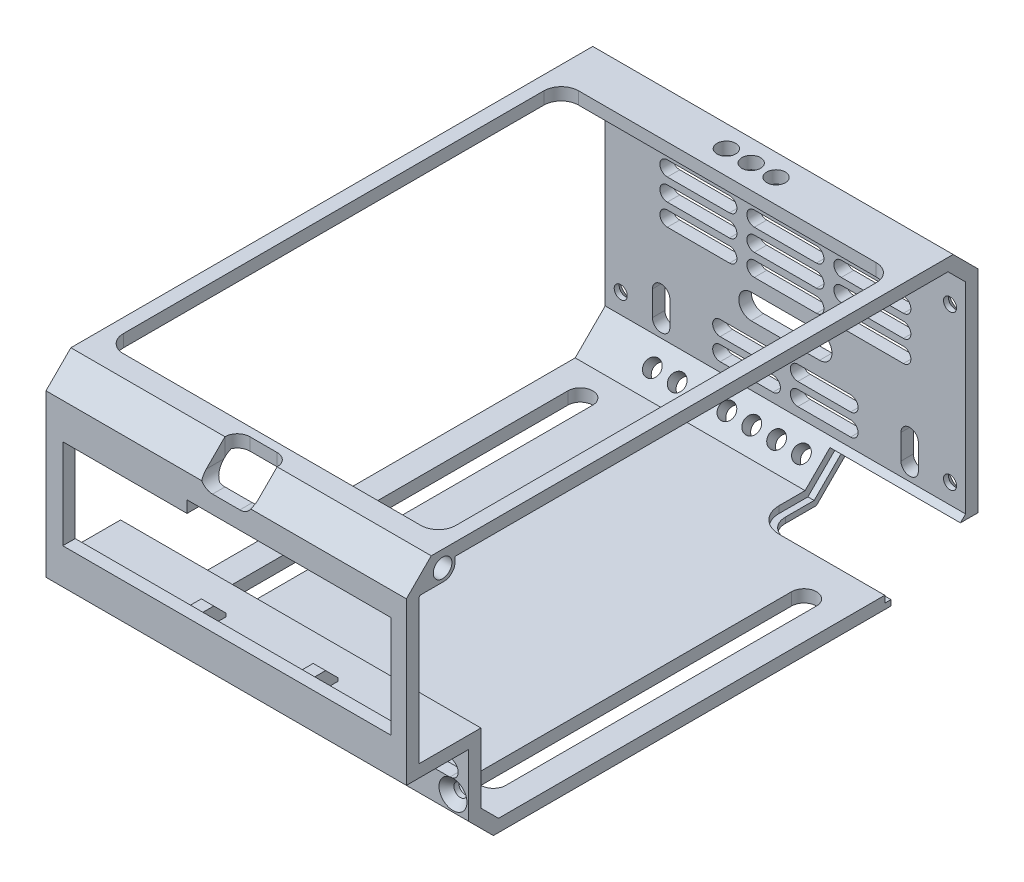
from build123d import *

# Parameters (mm, degrees)
SKETCH_1_W           = 58
SKETCH_1_H           = 92
EXTRUDE_1_DEPTH      = 44
SKETCH_2_W           = 10
SKETCH_2_H           = 14
CUT_EXTRUDE_1_DEPTH  = 92.533461314
CHAMFER_1_SIZE       = 4
CHAMFER_2_SIZE       = 6
CUT_EXTRUDE_2_DEPTH  = 92.533461314
CUT_EXTRUDE_3_REACH  = 108.07
CUT_EXTRUDE_4_REACH  = 78.585
SKETCH_7_W           = 8.4
SKETCH_7_H           = 6
CUT_EXTRUDE_5_DEPTH  = 5
FILLET_1_R           = 2
CUT_EXTRUDE_6_REACH  = 78.585
SKETCH_8_R           = 1.5
SKETCH_9_W           = 2
SKETCH_9_H           = 5
EXTRUDE_2_DEPTH      = 2.5
CHAMFER_4_SIZE       = 2
CHAMFER_5_SIZE       = 2
SKETCH_10_W          = 2
SKETCH_10_H          = 4
SKETCH_10_H_2        = 5
EXTRUDE_3_DEPTH      = 2.6
CUT_EXTRUDE_7_REACH  = 99.523
CUT_EXTRUDE_8_REACH  = 99.523
SKETCH_12_W          = 3.45
SKETCH_12_H          = 2
CUT_EXTRUDE_9_REACH  = 107.366
CUT_EXTRUDE_10_REACH = 108.07
CUT_EXTRUDE_11_REACH = 108.07
CUT_EXTRUDE_12_REACH = 98.782
SKETCH_17_R          = 1.3
CUT_EXTRUDE_13_REACH = 78.585
CUT_EXTRUDE_14_REACH = 108.07
SKETCH_19_R          = 1.05
CUT_EXTRUDE_15_REACH = 99.523
SKETCH_20_R          = 1.05
CHAMFER_6_SIZE       = 1.2
EXTRUDE_4_DEPTH      = 2.5
EXTRUDE_5_DEPTH      = 2.5
SKETCH_23_R          = 1.5
CUT_EXTRUDE_16_DEPTH = 2.5
CUT_EXTRUDE_START    = -2.5
SKETCH_24_R          = 1.5
CUT_EXTRUDE_17_DEPTH = 2.5
FILLET_3_R           = 1.8
SKETCH_25_W          = 15
SKETCH_25_H          = 8
CUT_EXTRUDE_18_DEPTH = 21
EXTRUDE_7_DEPTH      = 1
SKETCH_28_W          = 20
SKETCH_28_H          = 0.9
EXTRUDE_8_DEPTH      = 1
FILLET_4_R           = 3
FILLET_5_R           = 4


with BuildPart() as part:
    # 草图1 → 凸台-拉伸1 (new body)
    with BuildSketch(Plane(origin=(0, 0, 0), x_dir=(1, 0, 0), z_dir=(0, 1, 0))):
        with Locations((0.168986083, -9.483101392)):
            Rectangle(SKETCH_1_W, SKETCH_1_H)
    extrude(amount=EXTRUDE_1_DEPTH)

    # 草图2 → 切除-拉伸1 (cut, through all)
    with BuildSketch(Plane.ZY.offset(28.831013917)):
        with Locations((50.483101392, 7)):
            Rectangle(SKETCH_2_W, SKETCH_2_H)
    extrude(amount=-CUT_EXTRUDE_1_DEPTH, mode=Mode.SUBTRACT)

    # 倒角1
    chamfer_1_edges = [part.edges().sort_by_distance(p)[0] for p in [
        (0.168986083, 44, -36.516898608),
        (0.168986083, 0, 45.483101392),
        (0.168986083, 44, 55.483101392),
    ]]
    chamfer(chamfer_1_edges, length=CHAMFER_1_SIZE)

    # 倒角2
    chamfer_2_edges = [part.edges().sort_by_distance(p)[0] for p in [
        (0.168986083, 0, -36.516898608),
    ]]
    chamfer(chamfer_2_edges, length=CHAMFER_2_SIZE)

    # 草图3 → 切除-拉伸2 (cut, through all)
    with BuildSketch(Plane.ZY.offset(28.831013917)):
        Polygon((-34.516898608, 39.171572875), (-34.516898608, 6.828427125), (-29.688471484, 2), (40.654674267, 2), (43.483101392, 4.828427125), (43.483101392, 16), (53.483101392, 16), (53.483101392, 39.171572875), (50.654674267, 42), (-31.688471484, 42), align=None)
    extrude(amount=-CUT_EXTRUDE_2_DEPTH, mode=Mode.SUBTRACT)

    # 草图4 → 切除-拉伸3 (cut, up to next)
    with BuildSketch(Plane.XY.offset(55.483101392), mode=Mode.PRIVATE) as cut_extrude_3_sk1:
        Polygon((26.668986083, 36.15), (-6.131013917, 36.15), (-6.131013917, 34.25), (-26.131013917, 34.25), (-26.131013917, 19.75), (26.668986083, 19.75), align=None)
    cut_extrude_3_tool1 = extrude(cut_extrude_3_sk1.sketch, amount=-CUT_EXTRUDE_3_REACH, mode=Mode.PRIVATE) & part.part
    add(cut_extrude_3_tool1.solids().sort_by_distance((1.021716, 27.617238, 55.483101))[0], mode=Mode.SUBTRACT)

    # 草图6 → 切除-拉伸4 (cut, up to next)
    with BuildSketch(Plane(origin=(0, 44, 0), x_dir=(1, 0, 0), z_dir=(0, 1, 0)), mode=Mode.PRIVATE) as cut_extrude_4_sk1:
        with BuildLine():
            Line((24.118986083, -48.083101392), (-23.781013917, -48.083101392))
            ThreePointArc((-23.781013917, -48.083101392), (-25.760912904, -47.263000379), (-26.581013917, -45.283101392))
            Line((-26.581013917, -45.283101392), (-26.581013917, 22.388471484))
            ThreePointArc((-26.581013917, 22.388471484), (-25.760912904, 24.368370471), (-23.781013917, 25.188471484))
            Line((-23.781013917, 25.188471484), (24.118986083, 25.188471484))
            ThreePointArc((24.118986083, 25.188471484), (26.098885071, 24.368370471), (26.918986083, 22.388471484))
            Line((26.918986083, 22.388471484), (26.918986083, -45.283101392))
            ThreePointArc((26.918986083, -45.283101392), (26.098885071, -47.263000379), (24.118986083, -48.083101392))
        make_face()
    cut_extrude_4_tool1 = extrude(cut_extrude_4_sk1.sketch, amount=-CUT_EXTRUDE_4_REACH, mode=Mode.PRIVATE) & part.part
    add(cut_extrude_4_tool1.solids().sort_by_distance((0.168986, 44, 11.447315))[0], mode=Mode.SUBTRACT)

    # 草图7 → 切除-拉伸5 (cut)
    with BuildSketch(Plane(origin=(0, 44, 0), x_dir=(1, 0, 0), z_dir=(0, 1, 0))):
        with Locations((0.168986083, -52.483101392)):
            Rectangle(SKETCH_7_W, SKETCH_7_H)
    extrude(amount=-CUT_EXTRUDE_5_DEPTH, mode=Mode.SUBTRACT)

    # 圆角1
    fillet_1_edges = [part.edges().sort_by_distance(p)[0] for p in [
        (-4.031013917, 39, 54.483101392),
        (4.368986083, 39, 54.483101392),
        (-4.031013917, 43, 49.483101392),
        (4.368986083, 43, 49.483101392),
    ]]
    fillet(fillet_1_edges, radius=FILLET_1_R)

    # 草图8 → 切除-拉伸6 (cut, up to next)
    with BuildSketch(Plane(origin=(0, 44, 0), x_dir=(1, 0, 0), z_dir=(0, 1, 0)), mode=Mode.PRIVATE) as cut_extrude_6_sk1:
        with Locations(Location((4.168986083, 29.016898608, 0), (0, 0, 270))):
            Circle(SKETCH_8_R)
    cut_extrude_6_tool1 = extrude(cut_extrude_6_sk1.sketch, amount=-CUT_EXTRUDE_6_REACH, mode=Mode.PRIVATE) & part.part
    # 草图8 → 切除-拉伸6 (cut, up to next)
    with BuildSketch(Plane(origin=(0, 44, 0), x_dir=(1, 0, 0), z_dir=(0, 1, 0)), mode=Mode.PRIVATE) as cut_extrude_6_sk2:
        with Locations(Location((0.168986083, 29.016898608, 0), (0, 0, 270))):
            Circle(SKETCH_8_R)
    cut_extrude_6_tool2 = extrude(cut_extrude_6_sk2.sketch, amount=-CUT_EXTRUDE_6_REACH, mode=Mode.PRIVATE) & part.part
    # 草图8 → 切除-拉伸6 (cut, up to next)
    with BuildSketch(Plane(origin=(0, 44, 0), x_dir=(1, 0, 0), z_dir=(0, 1, 0)), mode=Mode.PRIVATE) as cut_extrude_6_sk3:
        with Locations(Location((-3.831013917, 29.016898608, 0), (0, 0, 270))):
            Circle(SKETCH_8_R)
    cut_extrude_6_tool3 = extrude(cut_extrude_6_sk3.sketch, amount=-CUT_EXTRUDE_6_REACH, mode=Mode.PRIVATE) & part.part
    add(cut_extrude_6_tool1.solids().sort_by_distance((4.168986, 44, -29.016899))[0], mode=Mode.SUBTRACT)
    add(cut_extrude_6_tool2.solids().sort_by_distance((0.168986, 44, -29.016899))[0], mode=Mode.SUBTRACT)
    add(cut_extrude_6_tool3.solids().sort_by_distance((-3.831014, 44, -29.016899))[0], mode=Mode.SUBTRACT)

    # 草图9 → 凸台-拉伸2 (add)
    with BuildSketch(Plane(origin=(0, 16, 0), x_dir=(1, 0, 0), z_dir=(0, 1, 0))):
        with Locations((10.168986083, -50.983101392)):
            Rectangle(SKETCH_9_W, SKETCH_9_H)
        with Locations((-7.831013917, -50.983101392)):
            Rectangle(SKETCH_9_W, SKETCH_9_H)
    extrude(amount=EXTRUDE_2_DEPTH)

    # 倒角4
    chamfer_4_edges = [part.edges().sort_by_distance(p)[0] for p in [
        (10.168986083, 18.5, 48.483101392),
    ]]
    chamfer(chamfer_4_edges, length=CHAMFER_4_SIZE)

    # 倒角5
    chamfer_5_edges = [part.edges().sort_by_distance(p)[0] for p in [
        (-7.831013917, 18.5, 48.483101392),
    ]]
    chamfer(chamfer_5_edges, length=CHAMFER_5_SIZE)

    # 草图10 → 凸台-拉伸3 (add)
    with BuildSketch(Plane(origin=(0, 42, 0), x_dir=(-1, 0, 0), z_dir=(0, -1, 0))):
        with Locations((19.831013917, -51.483101392)):
            Rectangle(SKETCH_10_W, SKETCH_10_H)
        with Locations((-20.168986083, -51.483101392)):
            Rectangle(SKETCH_10_W, SKETCH_10_H)
        with Locations((-12.168986083, 32.016898608)):
            Rectangle(SKETCH_10_W, SKETCH_10_H_2)
        with Locations((11.831013917, 32.016898608)):
            Rectangle(SKETCH_10_W, SKETCH_10_H_2)
    extrude(amount=EXTRUDE_3_DEPTH)

    # 草图11 → 切除-拉伸7 (cut, up to next)
    with BuildSketch(Plane.XY.offset(45.483101392), mode=Mode.PRIVATE) as cut_extrude_7_sk1:
        with BuildLine():
            Line((26.168986084, 8.66), (-25.831013917, 8.66))
            ThreePointArc((-25.831013917, 8.66), (-27.171013917, 10), (-25.831013917, 11.34))
            Line((-25.831013917, 11.34), (26.168986084, 11.34))
            ThreePointArc((26.168986084, 11.34), (27.508986084, 10), (26.168986084, 8.66))
        make_face()
    cut_extrude_7_tool1 = extrude(cut_extrude_7_sk1.sketch, amount=-CUT_EXTRUDE_7_REACH, mode=Mode.PRIVATE) & part.part
    add(cut_extrude_7_tool1.solids().sort_by_distance((0.168986, 10, 45.483101))[0], mode=Mode.SUBTRACT)

    # 草图12 → 切除-拉伸8 (cut, up to next)
    with BuildSketch(Plane.XY.offset(45.483101392), mode=Mode.PRIVATE) as cut_extrude_8_sk1:
        with Locations((-22.156013917, 12.34)):
            Rectangle(SKETCH_12_W, SKETCH_12_H)
    cut_extrude_8_tool1 = extrude(cut_extrude_8_sk1.sketch, amount=-CUT_EXTRUDE_8_REACH, mode=Mode.PRIVATE) & part.part
    # 草图12 → 切除-拉伸8 (cut, up to next)
    with BuildSketch(Plane.XY.offset(45.483101392), mode=Mode.PRIVATE) as cut_extrude_8_sk2:
        with Locations((-8.156013917, 12.34)):
            Rectangle(SKETCH_12_W, SKETCH_12_H)
    cut_extrude_8_tool2 = extrude(cut_extrude_8_sk2.sketch, amount=-CUT_EXTRUDE_8_REACH, mode=Mode.PRIVATE) & part.part
    add(cut_extrude_8_tool1.solids().sort_by_distance((-22.156014, 12.34, 45.483101))[0], mode=Mode.SUBTRACT)
    add(cut_extrude_8_tool2.solids().sort_by_distance((-8.156014, 12.34, 45.483101))[0], mode=Mode.SUBTRACT)

    # 草图13 → 切除-拉伸9 (cut, up to next)
    with BuildSketch(Plane(origin=(0, 38.258449304, -38.258449304), x_dir=(1, 0, 0), z_dir=(0, 0.707106781186546, -0.707106781186549)), mode=Mode.PRIVATE) as cut_extrude_9_sk1:
        with BuildLine():
            Line((6.168986083, -6.662924614), (-5.831013917, -6.662924614))
            ThreePointArc((-5.831013917, -6.662924614), (-7.031013917, -5.462924614), (-5.831013917, -4.262924614))
            Line((-5.831013917, -4.262924614), (6.168986083, -4.262924614))
            ThreePointArc((6.168986083, -4.262924614), (7.368986083, -5.462924614), (6.168986083, -6.662924614))
        make_face()
    cut_extrude_9_tool1 = extrude(cut_extrude_9_sk1.sketch, amount=-CUT_EXTRUDE_9_REACH, mode=Mode.PRIVATE) & part.part
    add(cut_extrude_9_tool1.solids().sort_by_distance((0.168986, 42.12132, -34.395578))[0], mode=Mode.SUBTRACT)

    # 草图14 → 切除-拉伸10 (cut, up to next)
    with BuildSketch(Plane(origin=(0, 0, -36.516898608), x_dir=(-1, 0, 0), z_dir=(0, 0, -1)), mode=Mode.PRIVATE) as cut_extrude_10_sk1:
        with BuildLine():
            Line((-5.668986083, 20.5), (5.331013917, 20.5))
            ThreePointArc((5.331013917, 20.5), (7.331013917, 18.5), (5.331013917, 16.5))
            Line((5.331013917, 16.5), (-5.668986083, 16.5))
            ThreePointArc((-5.668986083, 16.5), (-7.668986083, 18.5), (-5.668986083, 20.5))
        make_face()
    cut_extrude_10_tool1 = extrude(cut_extrude_10_sk1.sketch, amount=-CUT_EXTRUDE_10_REACH, mode=Mode.PRIVATE) & part.part
    add(cut_extrude_10_tool1.solids().sort_by_distance((0.168986, 18.5, -36.516899))[0], mode=Mode.SUBTRACT)

    # 草图15 → 切除-拉伸11 (cut, up to next)
    with BuildSketch(Plane(origin=(0, 0, -36.516898608), x_dir=(-1, 0, 0), z_dir=(0, 0, -1)), mode=Mode.PRIVATE) as cut_extrude_11_sk1:
        with BuildLine():
            Line((-9.168986083, 36.8), (-19.168986083, 36.8))
            ThreePointArc((-19.168986083, 36.8), (-20.368986083, 38), (-19.168986083, 39.2))
            Line((-19.168986083, 39.2), (-9.168986083, 39.2))
            ThreePointArc((-9.168986083, 39.2), (-7.968986083, 38), (-9.168986083, 36.8))
        make_face()
    cut_extrude_11_tool1 = extrude(cut_extrude_11_sk1.sketch, amount=-CUT_EXTRUDE_11_REACH, mode=Mode.PRIVATE) & part.part
    # 草图15 → 切除-拉伸11 (cut, up to next)
    with BuildSketch(Plane(origin=(0, 0, -36.516898608), x_dir=(-1, 0, 0), z_dir=(0, 0, -1)), mode=Mode.PRIVATE) as cut_extrude_11_sk2:
        with BuildLine():
            Line((4.831013917, 36.8), (-5.168986083, 36.8))
            ThreePointArc((-5.168986083, 36.8), (-6.368986083, 38), (-5.168986083, 39.2))
            Line((-5.168986083, 39.2), (4.831013917, 39.2))
            ThreePointArc((4.831013917, 39.2), (6.031013917, 38), (4.831013917, 36.8))
        make_face()
    cut_extrude_11_tool2 = extrude(cut_extrude_11_sk2.sketch, amount=-CUT_EXTRUDE_11_REACH, mode=Mode.PRIVATE) & part.part
    # 草图15 → 切除-拉伸11 (cut, up to next)
    with BuildSketch(Plane(origin=(0, 0, -36.516898608), x_dir=(-1, 0, 0), z_dir=(0, 0, -1)), mode=Mode.PRIVATE) as cut_extrude_11_sk3:
        with BuildLine():
            Line((4.831013917, 33.3), (-5.168986083, 33.3))
            ThreePointArc((-5.168986083, 33.3), (-6.368986083, 34.5), (-5.168986083, 35.7))
            Line((-5.168986083, 35.7), (4.831013917, 35.7))
            ThreePointArc((4.831013917, 35.7), (6.031013917, 34.5), (4.831013917, 33.3))
        make_face()
    cut_extrude_11_tool3 = extrude(cut_extrude_11_sk3.sketch, amount=-CUT_EXTRUDE_11_REACH, mode=Mode.PRIVATE) & part.part
    # 草图15 → 切除-拉伸11 (cut, up to next)
    with BuildSketch(Plane(origin=(0, 0, -36.516898608), x_dir=(-1, 0, 0), z_dir=(0, 0, -1)), mode=Mode.PRIVATE) as cut_extrude_11_sk4:
        with BuildLine():
            Line((4.831013917, 29.8), (-5.168986083, 29.8))
            ThreePointArc((-5.168986083, 29.8), (-6.368986083, 31), (-5.168986083, 32.2))
            Line((-5.168986083, 32.2), (4.831013917, 32.2))
            ThreePointArc((4.831013917, 32.2), (6.031013917, 31), (4.831013917, 29.8))
        make_face()
    cut_extrude_11_tool4 = extrude(cut_extrude_11_sk4.sketch, amount=-CUT_EXTRUDE_11_REACH, mode=Mode.PRIVATE) & part.part
    # 草图15 → 切除-拉伸11 (cut, up to next)
    with BuildSketch(Plane(origin=(0, 0, -36.516898608), x_dir=(-1, 0, 0), z_dir=(0, 0, -1)), mode=Mode.PRIVATE) as cut_extrude_11_sk5:
        with BuildLine():
            Line((18.831013917, 29.8), (8.831013917, 29.8))
            ThreePointArc((8.831013917, 29.8), (7.631013917, 31), (8.831013917, 32.2))
            Line((8.831013917, 32.2), (18.831013917, 32.2))
            ThreePointArc((18.831013917, 32.2), (20.031013917, 31), (18.831013917, 29.8))
        make_face()
    cut_extrude_11_tool5 = extrude(cut_extrude_11_sk5.sketch, amount=-CUT_EXTRUDE_11_REACH, mode=Mode.PRIVATE) & part.part
    # 草图15 → 切除-拉伸11 (cut, up to next)
    with BuildSketch(Plane(origin=(0, 0, -36.516898608), x_dir=(-1, 0, 0), z_dir=(0, 0, -1)), mode=Mode.PRIVATE) as cut_extrude_11_sk6:
        with BuildLine():
            Line((4.831013917, 26.3), (-5.168986083, 26.3))
            ThreePointArc((-5.168986083, 26.3), (-6.368986083, 27.5), (-5.168986083, 28.7))
            Line((-5.168986083, 28.7), (4.831013917, 28.7))
            ThreePointArc((4.831013917, 28.7), (6.031013917, 27.5), (4.831013917, 26.3))
        make_face()
    cut_extrude_11_tool6 = extrude(cut_extrude_11_sk6.sketch, amount=-CUT_EXTRUDE_11_REACH, mode=Mode.PRIVATE) & part.part
    # 草图15 → 切除-拉伸11 (cut, up to next)
    with BuildSketch(Plane(origin=(0, 0, -36.516898608), x_dir=(-1, 0, 0), z_dir=(0, 0, -1)), mode=Mode.PRIVATE) as cut_extrude_11_sk7:
        with BuildLine():
            Line((18.831013917, 26.3), (8.831013917, 26.3))
            ThreePointArc((8.831013917, 26.3), (7.631013917, 27.5), (8.831013917, 28.7))
            Line((8.831013917, 28.7), (18.831013917, 28.7))
            ThreePointArc((18.831013917, 28.7), (20.031013917, 27.5), (18.831013917, 26.3))
        make_face()
    cut_extrude_11_tool7 = extrude(cut_extrude_11_sk7.sketch, amount=-CUT_EXTRUDE_11_REACH, mode=Mode.PRIVATE) & part.part
    # 草图15 → 切除-拉伸11 (cut, up to next)
    with BuildSketch(Plane(origin=(0, 0, -36.516898608), x_dir=(-1, 0, 0), z_dir=(0, 0, -1)), mode=Mode.PRIVATE) as cut_extrude_11_sk8:
        with BuildLine():
            Line((4.831013917, 22.8), (-5.168986083, 22.8))
            ThreePointArc((-5.168986083, 22.8), (-6.368986083, 24), (-5.168986083, 25.2))
            Line((-5.168986083, 25.2), (4.831013917, 25.2))
            ThreePointArc((4.831013917, 25.2), (6.031013917, 24), (4.831013917, 22.8))
        make_face()
    cut_extrude_11_tool8 = extrude(cut_extrude_11_sk8.sketch, amount=-CUT_EXTRUDE_11_REACH, mode=Mode.PRIVATE) & part.part
    # 草图15 → 切除-拉伸11 (cut, up to next)
    with BuildSketch(Plane(origin=(0, 0, -36.516898608), x_dir=(-1, 0, 0), z_dir=(0, 0, -1)), mode=Mode.PRIVATE) as cut_extrude_11_sk9:
        with BuildLine():
            Line((18.831013917, 22.8), (8.831013917, 22.8))
            ThreePointArc((8.831013917, 22.8), (7.631013917, 24), (8.831013917, 25.2))
            Line((8.831013917, 25.2), (18.831013917, 25.2))
            ThreePointArc((18.831013917, 25.2), (20.031013917, 24), (18.831013917, 22.8))
        make_face()
    cut_extrude_11_tool9 = extrude(cut_extrude_11_sk9.sketch, amount=-CUT_EXTRUDE_11_REACH, mode=Mode.PRIVATE) & part.part
    # 草图15 → 切除-拉伸11 (cut, up to next)
    with BuildSketch(Plane(origin=(0, 0, -36.516898608), x_dir=(-1, 0, 0), z_dir=(0, 0, -1)), mode=Mode.PRIVATE) as cut_extrude_11_sk10:
        with BuildLine():
            Line((-9.168986083, 33.3), (-19.168986083, 33.3))
            ThreePointArc((-19.168986083, 33.3), (-20.368986083, 34.5), (-19.168986083, 35.7))
            Line((-19.168986083, 35.7), (-9.168986083, 35.7))
            ThreePointArc((-9.168986083, 35.7), (-7.968986083, 34.5), (-9.168986083, 33.3))
        make_face()
    cut_extrude_11_tool10 = extrude(cut_extrude_11_sk10.sketch, amount=-CUT_EXTRUDE_11_REACH, mode=Mode.PRIVATE) & part.part
    # 草图15 → 切除-拉伸11 (cut, up to next)
    with BuildSketch(Plane(origin=(0, 0, -36.516898608), x_dir=(-1, 0, 0), z_dir=(0, 0, -1)), mode=Mode.PRIVATE) as cut_extrude_11_sk11:
        with BuildLine():
            Line((-9.168986083, 29.8), (-19.168986083, 29.8))
            ThreePointArc((-19.168986083, 29.8), (-20.368986083, 31), (-19.168986083, 32.2))
            Line((-19.168986083, 32.2), (-9.168986083, 32.2))
            ThreePointArc((-9.168986083, 32.2), (-7.968986083, 31), (-9.168986083, 29.8))
        make_face()
    cut_extrude_11_tool11 = extrude(cut_extrude_11_sk11.sketch, amount=-CUT_EXTRUDE_11_REACH, mode=Mode.PRIVATE) & part.part
    # 草图15 → 切除-拉伸11 (cut, up to next)
    with BuildSketch(Plane(origin=(0, 0, -36.516898608), x_dir=(-1, 0, 0), z_dir=(0, 0, -1)), mode=Mode.PRIVATE) as cut_extrude_11_sk12:
        with BuildLine():
            Line((-9.168986083, 26.3), (-19.168986083, 26.3))
            ThreePointArc((-19.168986083, 26.3), (-20.368986083, 27.5), (-19.168986083, 28.7))
            Line((-19.168986083, 28.7), (-9.168986083, 28.7))
            ThreePointArc((-9.168986083, 28.7), (-7.968986083, 27.5), (-9.168986083, 26.3))
        make_face()
    cut_extrude_11_tool12 = extrude(cut_extrude_11_sk12.sketch, amount=-CUT_EXTRUDE_11_REACH, mode=Mode.PRIVATE) & part.part
    # 草图15 → 切除-拉伸11 (cut, up to next)
    with BuildSketch(Plane(origin=(0, 0, -36.516898608), x_dir=(-1, 0, 0), z_dir=(0, 0, -1)), mode=Mode.PRIVATE) as cut_extrude_11_sk13:
        with BuildLine():
            Line((-9.168986083, 22.8), (-19.168986083, 22.8))
            ThreePointArc((-19.168986083, 22.8), (-20.368986083, 24), (-19.168986083, 25.2))
            Line((-19.168986083, 25.2), (-9.168986083, 25.2))
            ThreePointArc((-9.168986083, 25.2), (-7.968986083, 24), (-9.168986083, 22.8))
        make_face()
    cut_extrude_11_tool13 = extrude(cut_extrude_11_sk13.sketch, amount=-CUT_EXTRUDE_11_REACH, mode=Mode.PRIVATE) & part.part
    # 草图15 → 切除-拉伸11 (cut, up to next)
    with BuildSketch(Plane(origin=(0, 0, -36.516898608), x_dir=(-1, 0, 0), z_dir=(0, 0, -1)), mode=Mode.PRIVATE) as cut_extrude_11_sk14:
        with BuildLine():
            Line((-18.768986083, 13), (-18.768986083, 9))
            ThreePointArc((-18.768986083, 9), (-20.168986083, 7.6), (-21.568986083, 9))
            Line((-21.568986083, 9), (-21.568986083, 13))
            ThreePointArc((-21.568986083, 13), (-20.168986083, 14.4), (-18.768986083, 13))
        make_face()
    cut_extrude_11_tool14 = extrude(cut_extrude_11_sk14.sketch, amount=-CUT_EXTRUDE_11_REACH, mode=Mode.PRIVATE) & part.part
    # 草图15 → 切除-拉伸11 (cut, up to next)
    with BuildSketch(Plane(origin=(0, 0, -36.516898608), x_dir=(-1, 0, 0), z_dir=(0, 0, -1)), mode=Mode.PRIVATE) as cut_extrude_11_sk15:
        with BuildLine():
            Line((18.431013917, 13), (18.431013917, 9))
            ThreePointArc((18.431013917, 9), (19.831013917, 7.6), (21.231013917, 9))
            Line((21.231013917, 9), (21.231013917, 13))
            ThreePointArc((21.231013917, 13), (19.831013917, 14.4), (18.431013917, 13))
        make_face()
    cut_extrude_11_tool15 = extrude(cut_extrude_11_sk15.sketch, amount=-CUT_EXTRUDE_11_REACH, mode=Mode.PRIVATE) & part.part
    # 草图15 → 切除-拉伸11 (cut, up to next)
    with BuildSketch(Plane(origin=(0, 0, -36.516898608), x_dir=(-1, 0, 0), z_dir=(0, 0, -1)), mode=Mode.PRIVATE) as cut_extrude_11_sk16:
        with BuildLine():
            Line((-10.668986083, 14.2), (-2.168986083, 14.2))
            ThreePointArc((-2.168986083, 14.2), (-0.968986083, 13), (-2.168986083, 11.8))
            Line((-2.168986083, 11.8), (-10.668986083, 11.8))
            ThreePointArc((-10.668986083, 11.8), (-11.868986083, 13), (-10.668986083, 14.2))
        make_face()
    cut_extrude_11_tool16 = extrude(cut_extrude_11_sk16.sketch, amount=-CUT_EXTRUDE_11_REACH, mode=Mode.PRIVATE) & part.part
    # 草图15 → 切除-拉伸11 (cut, up to next)
    with BuildSketch(Plane(origin=(0, 0, -36.516898608), x_dir=(-1, 0, 0), z_dir=(0, 0, -1)), mode=Mode.PRIVATE) as cut_extrude_11_sk17:
        with BuildLine():
            Line((-10.668986083, 10.7), (-2.168986083, 10.7))
            ThreePointArc((-2.168986083, 10.7), (-0.968986083, 9.5), (-2.168986083, 8.3))
            Line((-2.168986083, 8.3), (-10.668986083, 8.3))
            ThreePointArc((-10.668986083, 8.3), (-11.868986083, 9.5), (-10.668986083, 10.7))
        make_face()
    cut_extrude_11_tool17 = extrude(cut_extrude_11_sk17.sketch, amount=-CUT_EXTRUDE_11_REACH, mode=Mode.PRIVATE) & part.part
    # 草图15 → 切除-拉伸11 (cut, up to next)
    with BuildSketch(Plane(origin=(0, 0, -36.516898608), x_dir=(-1, 0, 0), z_dir=(0, 0, -1)), mode=Mode.PRIVATE) as cut_extrude_11_sk18:
        with BuildLine():
            Line((10.331013917, 14.2), (1.831013917, 14.2))
            ThreePointArc((1.831013917, 14.2), (0.631013917, 13), (1.831013917, 11.8))
            Line((1.831013917, 11.8), (10.331013917, 11.8))
            ThreePointArc((10.331013917, 11.8), (11.531013917, 13), (10.331013917, 14.2))
        make_face()
    cut_extrude_11_tool18 = extrude(cut_extrude_11_sk18.sketch, amount=-CUT_EXTRUDE_11_REACH, mode=Mode.PRIVATE) & part.part
    # 草图15 → 切除-拉伸11 (cut, up to next)
    with BuildSketch(Plane(origin=(0, 0, -36.516898608), x_dir=(-1, 0, 0), z_dir=(0, 0, -1)), mode=Mode.PRIVATE) as cut_extrude_11_sk19:
        with BuildLine():
            Line((10.331013917, 10.7), (1.831013917, 10.7))
            ThreePointArc((1.831013917, 10.7), (0.631013917, 9.5), (1.831013917, 8.3))
            Line((1.831013917, 8.3), (10.331013917, 8.3))
            ThreePointArc((10.331013917, 8.3), (11.531013917, 9.5), (10.331013917, 10.7))
        make_face()
    cut_extrude_11_tool19 = extrude(cut_extrude_11_sk19.sketch, amount=-CUT_EXTRUDE_11_REACH, mode=Mode.PRIVATE) & part.part
    # 草图15 → 切除-拉伸11 (cut, up to next)
    with BuildSketch(Plane(origin=(0, 0, -36.516898608), x_dir=(-1, 0, 0), z_dir=(0, 0, -1)), mode=Mode.PRIVATE) as cut_extrude_11_sk20:
        with BuildLine():
            Line((9.831013917, 39.2), (21.831013917, 39.2))
            ThreePointArc((21.831013917, 39.2), (22.538120698, 38.907106781), (22.831013917, 38.2))
            Line((22.831013917, 38.2), (22.831013917, 34.3))
            ThreePointArc((22.831013917, 34.3), (22.538120698, 33.592893219), (21.831013917, 33.3))
            Line((21.831013917, 33.3), (9.831013917, 33.3))
            ThreePointArc((9.831013917, 33.3), (9.123907135, 33.592893219), (8.831013917, 34.3))
            Line((8.831013917, 34.3), (8.831013917, 38.2))
            ThreePointArc((8.831013917, 38.2), (9.123907135, 38.907106781), (9.831013917, 39.2))
        make_face()
    cut_extrude_11_tool20 = extrude(cut_extrude_11_sk20.sketch, amount=-CUT_EXTRUDE_11_REACH, mode=Mode.PRIVATE) & part.part
    add(cut_extrude_11_tool1.solids().sort_by_distance((14.168986, 38, -36.516899))[0], mode=Mode.SUBTRACT)
    add(cut_extrude_11_tool2.solids().sort_by_distance((0.168986, 38, -36.516899))[0], mode=Mode.SUBTRACT)
    add(cut_extrude_11_tool3.solids().sort_by_distance((0.168986, 34.5, -36.516899))[0], mode=Mode.SUBTRACT)
    add(cut_extrude_11_tool4.solids().sort_by_distance((0.168986, 31, -36.516899))[0], mode=Mode.SUBTRACT)
    add(cut_extrude_11_tool5.solids().sort_by_distance((-13.831014, 31, -36.516899))[0], mode=Mode.SUBTRACT)
    add(cut_extrude_11_tool6.solids().sort_by_distance((0.168986, 27.5, -36.516899))[0], mode=Mode.SUBTRACT)
    add(cut_extrude_11_tool7.solids().sort_by_distance((-13.831014, 27.5, -36.516899))[0], mode=Mode.SUBTRACT)
    add(cut_extrude_11_tool8.solids().sort_by_distance((0.168986, 24, -36.516899))[0], mode=Mode.SUBTRACT)
    add(cut_extrude_11_tool9.solids().sort_by_distance((-13.831014, 24, -36.516899))[0], mode=Mode.SUBTRACT)
    add(cut_extrude_11_tool10.solids().sort_by_distance((14.168986, 34.5, -36.516899))[0], mode=Mode.SUBTRACT)
    add(cut_extrude_11_tool11.solids().sort_by_distance((14.168986, 31, -36.516899))[0], mode=Mode.SUBTRACT)
    add(cut_extrude_11_tool12.solids().sort_by_distance((14.168986, 27.5, -36.516899))[0], mode=Mode.SUBTRACT)
    add(cut_extrude_11_tool13.solids().sort_by_distance((14.168986, 24, -36.516899))[0], mode=Mode.SUBTRACT)
    add(cut_extrude_11_tool14.solids().sort_by_distance((20.168986, 11, -36.516899))[0], mode=Mode.SUBTRACT)
    add(cut_extrude_11_tool15.solids().sort_by_distance((-19.831014, 11, -36.516899))[0], mode=Mode.SUBTRACT)
    add(cut_extrude_11_tool16.solids().sort_by_distance((6.418986, 13, -36.516899))[0], mode=Mode.SUBTRACT)
    add(cut_extrude_11_tool17.solids().sort_by_distance((6.418986, 9.5, -36.516899))[0], mode=Mode.SUBTRACT)
    add(cut_extrude_11_tool18.solids().sort_by_distance((-6.081014, 13, -36.516899))[0], mode=Mode.SUBTRACT)
    add(cut_extrude_11_tool19.solids().sort_by_distance((-6.081014, 9.5, -36.516899))[0], mode=Mode.SUBTRACT)
    add(cut_extrude_11_tool20.solids().sort_by_distance((-15.831014, 36.25, -36.516899))[0], mode=Mode.SUBTRACT)

    # 草图17 → 切除-拉伸12 (cut, up to next)
    with BuildSketch(Plane(origin=(0, -15.258449304, -15.258449304), x_dir=(1, 0, 0), z_dir=(0, -0.7071067811865483, -0.7071067811865468)), mode=Mode.PRIVATE) as cut_extrude_12_sk1:
        with Locations(Location((5.168986083, -25.821346634, 0), (0, 0, 270))):
            Circle(SKETCH_17_R)
    cut_extrude_12_tool1 = extrude(cut_extrude_12_sk1.sketch, amount=-CUT_EXTRUDE_12_REACH, mode=Mode.PRIVATE) & part.part
    # 草图17 → 切除-拉伸12 (cut, up to next)
    with BuildSketch(Plane(origin=(0, -15.258449304, -15.258449304), x_dir=(1, 0, 0), z_dir=(0, -0.7071067811865483, -0.7071067811865468)), mode=Mode.PRIVATE) as cut_extrude_12_sk2:
        with Locations(Location((1.168986083, -25.821346634, 0), (0, 0, 270))):
            Circle(SKETCH_17_R)
    cut_extrude_12_tool2 = extrude(cut_extrude_12_sk2.sketch, amount=-CUT_EXTRUDE_12_REACH, mode=Mode.PRIVATE) & part.part
    # 草图17 → 切除-拉伸12 (cut, up to next)
    with BuildSketch(Plane(origin=(0, -15.258449304, -15.258449304), x_dir=(1, 0, 0), z_dir=(0, -0.7071067811865483, -0.7071067811865468)), mode=Mode.PRIVATE) as cut_extrude_12_sk3:
        with Locations(Location((-2.831013917, -25.821346634, 0), (0, 0, 270))):
            Circle(SKETCH_17_R)
    cut_extrude_12_tool3 = extrude(cut_extrude_12_sk3.sketch, amount=-CUT_EXTRUDE_12_REACH, mode=Mode.PRIVATE) & part.part
    # 草图17 → 切除-拉伸12 (cut, up to next)
    with BuildSketch(Plane(origin=(0, -15.258449304, -15.258449304), x_dir=(1, 0, 0), z_dir=(0, -0.7071067811865483, -0.7071067811865468)), mode=Mode.PRIVATE) as cut_extrude_12_sk4:
        with Locations(Location((-6.831013917, -25.821346634, 0), (0, 0, 270))):
            Circle(SKETCH_17_R)
    cut_extrude_12_tool4 = extrude(cut_extrude_12_sk4.sketch, amount=-CUT_EXTRUDE_12_REACH, mode=Mode.PRIVATE) & part.part
    # 草图17 → 切除-拉伸12 (cut, up to next)
    with BuildSketch(Plane(origin=(0, -15.258449304, -15.258449304), x_dir=(1, 0, 0), z_dir=(0, -0.7071067811865483, -0.7071067811865468)), mode=Mode.PRIVATE) as cut_extrude_12_sk5:
        with Locations(Location((-10.831013917, -25.821346634, 0), (0, 0, 270))):
            Circle(SKETCH_17_R)
    cut_extrude_12_tool5 = extrude(cut_extrude_12_sk5.sketch, amount=-CUT_EXTRUDE_12_REACH, mode=Mode.PRIVATE) & part.part
    # 草图17 → 切除-拉伸12 (cut, up to next)
    with BuildSketch(Plane(origin=(0, -15.258449304, -15.258449304), x_dir=(1, 0, 0), z_dir=(0, -0.7071067811865483, -0.7071067811865468)), mode=Mode.PRIVATE) as cut_extrude_12_sk6:
        with Locations(Location((-14.831013917, -25.821346634, 0), (0, 0, 270))):
            Circle(SKETCH_17_R)
    cut_extrude_12_tool6 = extrude(cut_extrude_12_sk6.sketch, amount=-CUT_EXTRUDE_12_REACH, mode=Mode.PRIVATE) & part.part
    # 草图17 → 切除-拉伸12 (cut, up to next)
    with BuildSketch(Plane(origin=(0, -15.258449304, -15.258449304), x_dir=(1, 0, 0), z_dir=(0, -0.7071067811865483, -0.7071067811865468)), mode=Mode.PRIVATE) as cut_extrude_12_sk7:
        with Locations(Location((-18.831013917, -25.821346634, 0), (0, 0, 270))):
            Circle(SKETCH_17_R)
    cut_extrude_12_tool7 = extrude(cut_extrude_12_sk7.sketch, amount=-CUT_EXTRUDE_12_REACH, mode=Mode.PRIVATE) & part.part
    add(cut_extrude_12_tool1.solids().sort_by_distance((5.168986, 3, -33.516899))[0], mode=Mode.SUBTRACT)
    add(cut_extrude_12_tool2.solids().sort_by_distance((1.168986, 3, -33.516899))[0], mode=Mode.SUBTRACT)
    add(cut_extrude_12_tool3.solids().sort_by_distance((-2.831014, 3, -33.516899))[0], mode=Mode.SUBTRACT)
    add(cut_extrude_12_tool4.solids().sort_by_distance((-6.831014, 3, -33.516899))[0], mode=Mode.SUBTRACT)
    add(cut_extrude_12_tool5.solids().sort_by_distance((-10.831014, 3, -33.516899))[0], mode=Mode.SUBTRACT)
    add(cut_extrude_12_tool6.solids().sort_by_distance((-14.831014, 3, -33.516899))[0], mode=Mode.SUBTRACT)
    add(cut_extrude_12_tool7.solids().sort_by_distance((-18.831014, 3, -33.516899))[0], mode=Mode.SUBTRACT)

    # 草图18 → 切除-拉伸13 (cut, up to next)
    with BuildSketch(Plane.XZ, mode=Mode.PRIVATE) as cut_extrude_13_sk1:
        with BuildLine():
            Line((25.168986083, 35.483101392), (25.168986083, -14.516898608))
            ThreePointArc((25.168986083, -14.516898608), (23.168986083, -16.516898608), (21.168986083, -14.516898608))
            Line((21.168986083, -14.516898608), (21.168986083, 35.483101392))
            ThreePointArc((21.168986083, 35.483101392), (23.168986083, 37.483101392), (25.168986083, 35.483101392))
        make_face()
    cut_extrude_13_tool1 = extrude(cut_extrude_13_sk1.sketch, amount=-CUT_EXTRUDE_13_REACH, mode=Mode.PRIVATE) & part.part
    # 草图18 → 切除-拉伸13 (cut, up to next)
    with BuildSketch(Plane.XZ, mode=Mode.PRIVATE) as cut_extrude_13_sk2:
        with BuildLine():
            Line((-20.831013917, 35.483101392), (-20.831013917, -24.516898608))
            ThreePointArc((-20.831013917, -24.516898608), (-22.831013917, -26.516898608), (-24.831013917, -24.516898608))
            Line((-24.831013917, -24.516898608), (-24.831013917, 35.483101392))
            ThreePointArc((-24.831013917, 35.483101392), (-22.831013917, 37.483101392), (-20.831013917, 35.483101392))
        make_face()
    cut_extrude_13_tool2 = extrude(cut_extrude_13_sk2.sketch, amount=-CUT_EXTRUDE_13_REACH, mode=Mode.PRIVATE) & part.part
    add(cut_extrude_13_tool1.solids().sort_by_distance((23.168986, 0, 10.483101))[0], mode=Mode.SUBTRACT)
    add(cut_extrude_13_tool2.solids().sort_by_distance((-22.831014, 0, 5.483101))[0], mode=Mode.SUBTRACT)

    # 草图19 → 切除-拉伸14 (cut, up to next)
    with BuildSketch(Plane(origin=(0, 0, -36.516898608), x_dir=(-1, 0, 0), z_dir=(0, 0, -1)), mode=Mode.PRIVATE) as cut_extrude_14_sk1:
        with Locations((-26.668986084, 34.8)):
            Circle(SKETCH_19_R)
    cut_extrude_14_tool1 = extrude(cut_extrude_14_sk1.sketch, amount=-CUT_EXTRUDE_14_REACH, mode=Mode.PRIVATE) & part.part
    # 草图19 → 切除-拉伸14 (cut, up to next)
    with BuildSketch(Plane(origin=(0, 0, -36.516898608), x_dir=(-1, 0, 0), z_dir=(0, 0, -1)), mode=Mode.PRIVATE) as cut_extrude_14_sk2:
        with Locations((26.331013917, 34.8)):
            Circle(SKETCH_19_R)
    cut_extrude_14_tool2 = extrude(cut_extrude_14_sk2.sketch, amount=-CUT_EXTRUDE_14_REACH, mode=Mode.PRIVATE) & part.part
    # 草图19 → 切除-拉伸14 (cut, up to next)
    with BuildSketch(Plane(origin=(0, 0, -36.516898608), x_dir=(-1, 0, 0), z_dir=(0, 0, -1)), mode=Mode.PRIVATE) as cut_extrude_14_sk3:
        with Locations((-26.668986084, 10)):
            Circle(SKETCH_19_R)
    cut_extrude_14_tool3 = extrude(cut_extrude_14_sk3.sketch, amount=-CUT_EXTRUDE_14_REACH, mode=Mode.PRIVATE) & part.part
    # 草图19 → 切除-拉伸14 (cut, up to next)
    with BuildSketch(Plane(origin=(0, 0, -36.516898608), x_dir=(-1, 0, 0), z_dir=(0, 0, -1)), mode=Mode.PRIVATE) as cut_extrude_14_sk4:
        with Locations((26.331013917, 10)):
            Circle(SKETCH_19_R)
    cut_extrude_14_tool4 = extrude(cut_extrude_14_sk4.sketch, amount=-CUT_EXTRUDE_14_REACH, mode=Mode.PRIVATE) & part.part
    add(cut_extrude_14_tool1.solids().sort_by_distance((26.668986, 34.8, -36.516899))[0], mode=Mode.SUBTRACT)
    add(cut_extrude_14_tool2.solids().sort_by_distance((-26.331014, 34.8, -36.516899))[0], mode=Mode.SUBTRACT)
    add(cut_extrude_14_tool3.solids().sort_by_distance((26.668986, 10, -36.516899))[0], mode=Mode.SUBTRACT)
    add(cut_extrude_14_tool4.solids().sort_by_distance((-26.331014, 10, -36.516899))[0], mode=Mode.SUBTRACT)

    # 草图20 → 切除-拉伸15 (cut, up to next)
    with BuildSketch(Plane.XY.offset(45.483101392), mode=Mode.PRIVATE) as cut_extrude_15_sk1:
        with Locations((26.668986083, 6.5)):
            Circle(SKETCH_20_R)
    cut_extrude_15_tool1 = extrude(cut_extrude_15_sk1.sketch, amount=-CUT_EXTRUDE_15_REACH, mode=Mode.PRIVATE) & part.part
    # 草图20 → 切除-拉伸15 (cut, up to next)
    with BuildSketch(Plane.XY.offset(45.483101392), mode=Mode.PRIVATE) as cut_extrude_15_sk2:
        with Locations((-26.331013917, 6.5)):
            Circle(SKETCH_20_R)
    cut_extrude_15_tool2 = extrude(cut_extrude_15_sk2.sketch, amount=-CUT_EXTRUDE_15_REACH, mode=Mode.PRIVATE) & part.part
    add(cut_extrude_15_tool1.solids().sort_by_distance((26.668986, 6.5, 45.483101))[0], mode=Mode.SUBTRACT)
    add(cut_extrude_15_tool2.solids().sort_by_distance((-26.331014, 6.5, 45.483101))[0], mode=Mode.SUBTRACT)

    # 倒角6
    # the kernel refuses this chamfer: 1.2 mm, written as the material it takes off along each edge
    with BuildSketch(Plane(origin=(-26.331013917, 34.8, -36.516898608), x_dir=(-1, 0, 0), z_dir=(0, -1, 0))) as chamfer_6_piece_1:
        Polygon((1.05 + CHAMFER_6_SIZE, 0), (1.05, -CHAMFER_6_SIZE), (1.05, 0), align=None)
    revolve(axis=Axis((-26.331013917, 34.8, -36.516898608), (0, 0, -1)), mode=Mode.SUBTRACT)
    with BuildSketch(Plane(origin=(26.668986084, 10, -36.516898608), x_dir=(-1, 0, 0), z_dir=(0, -1, 0))) as chamfer_6_piece_2:
        Polygon((1.05 + CHAMFER_6_SIZE, 0), (1.05, -CHAMFER_6_SIZE), (1.05, 0), align=None)
    revolve(axis=Axis((26.668986084, 10, -36.516898608), (0, 0, -1)), mode=Mode.SUBTRACT)
    with BuildSketch(Plane(origin=(-26.331013917, 10, -36.516898608), x_dir=(-1, 0, 0), z_dir=(0, -1, 0))) as chamfer_6_piece_3:
        Polygon((1.05 + CHAMFER_6_SIZE, 0), (1.05, -CHAMFER_6_SIZE), (1.05, 0), align=None)
    revolve(axis=Axis((-26.331013917, 10, -36.516898608), (0, 0, -1)), mode=Mode.SUBTRACT)
    with BuildSketch(Plane(origin=(26.668986084, 34.8, -36.516898608), x_dir=(-1, 0, 0), z_dir=(0, -1, 0))) as chamfer_6_piece_4:
        Polygon((1.05 + CHAMFER_6_SIZE, 0), (1.05, -CHAMFER_6_SIZE), (1.05, 0), align=None)
    revolve(axis=Axis((26.668986084, 34.8, -36.516898608), (0, 0, -1)), mode=Mode.SUBTRACT)
    with BuildSketch(Plane(origin=(26.668986083, 6.5, 45.483101392), x_dir=(1, 0, 0), z_dir=(0, -1, 0))) as chamfer_6_piece_5:
        Polygon((1.05 + CHAMFER_6_SIZE, 0), (1.05, -CHAMFER_6_SIZE), (1.05, 0), align=None)
    revolve(axis=Axis((26.668986083, 6.5, 45.483101392), (0, 0, 1)), mode=Mode.SUBTRACT)
    with BuildSketch(Plane(origin=(-26.331013917, 6.5, 45.483101392), x_dir=(1, 0, 0), z_dir=(0, -1, 0))) as chamfer_6_piece_6:
        Polygon((1.05 + CHAMFER_6_SIZE, 0), (1.05, -CHAMFER_6_SIZE), (1.05, 0), align=None)
    revolve(axis=Axis((-26.331013917, 6.5, 45.483101392), (0, 0, 1)), mode=Mode.SUBTRACT)

    # 草图21 → 凸台-拉伸4 (add)
    with BuildSketch(Plane(origin=(29.168986083, 0, 0), x_dir=(0, 0, -1), z_dir=(1, 0, 0))):
        Polygon((-47.654674267, 42), (-50.654674267, 42), (-53.254674267, 39.4), (-47.654674267, 39.4), align=None)
    extrude(amount=-EXTRUDE_4_DEPTH)

    # 草图22 → 凸台-拉伸5 (add)
    with BuildSketch(Plane.ZY.offset(28.831013917)):
        Polygon((50.654674267, 42), (47.654674267, 42), (47.654674267, 39.4), (53.254674267, 39.4), align=None)
    extrude(amount=-EXTRUDE_5_DEPTH)

    # 草图23 → 切除-拉伸16 (cut)
    with BuildSketch(Plane.ZY.offset(28.831013917)):
        with Locations((49.654674267, 41.4)):
            Circle(SKETCH_23_R)
    extrude(amount=-CUT_EXTRUDE_16_DEPTH, mode=Mode.SUBTRACT)

    # 草图24 → 切除-拉伸17 (cut)
    with BuildSketch(Plane(origin=(29.168986083, 0, 0), x_dir=(0, 0, -1), z_dir=(1, 0, 0)).offset(CUT_EXTRUDE_START)):
        with Locations(Location((-49.654674267, 41.4, 0), (0, 0, 180))):
            Circle(SKETCH_24_R)
    extrude(amount=CUT_EXTRUDE_17_DEPTH, mode=Mode.SUBTRACT)

    # 圆角3
    fillet_3_edges = [part.edges().sort_by_distance(p)[0] for p in [
        (27.918986083, 39.4, 47.654674267),
        (-27.581013917, 39.4, 47.654674267),
    ]]
    fillet(fillet_3_edges, radius=FILLET_3_R)

    # 草图25 → 切除-拉伸18 (cut)
    with BuildSketch(Plane(origin=(29.168986083, 0, 0), x_dir=(0, 0, -1), z_dir=(1, 0, 0))):
        with Locations((29.016898608, 2)):
            Rectangle(SKETCH_25_W, SKETCH_25_H)
    extrude(amount=-CUT_EXTRUDE_18_DEPTH, mode=Mode.SUBTRACT)

    # 草图27 → 凸台-拉伸7 (add)
    with BuildSketch(Plane(origin=(8.168986083, 0, 0), x_dir=(0, 0, -1), z_dir=(1, 0, 0))):
        Polygon((21.516898608, 0.9), (30.144106402, 0.9), (35.244106402, 6), (36.516898608, 6), (30.516898608, 0), (21.516898608, 0), align=None)
    extrude(amount=EXTRUDE_7_DEPTH)

    # 草图28 → 凸台-拉伸8 (add)
    with BuildSketch(Plane(origin=(0, 0, -21.516898608), x_dir=(-1, 0, 0), z_dir=(0, 0, -1))):
        with Locations((-19.168986083, 0.45)):
            Rectangle(SKETCH_28_W, SKETCH_28_H)
    extrude(amount=EXTRUDE_8_DEPTH)

    # 圆角4
    fillet_4_edges = [part.edges().sort_by_distance(p)[0] for p in [
        (9.168986083, 0.45, -22.516898608),
    ]]
    fillet(fillet_4_edges, radius=FILLET_4_R)

    # 圆角5
    fillet_5_edges = [part.edges().sort_by_distance(p)[0] for p in [
        (8.168986083, 1.45, -21.516898608),
    ]]
    fillet(fillet_5_edges, radius=FILLET_5_R)


solid = part.part
